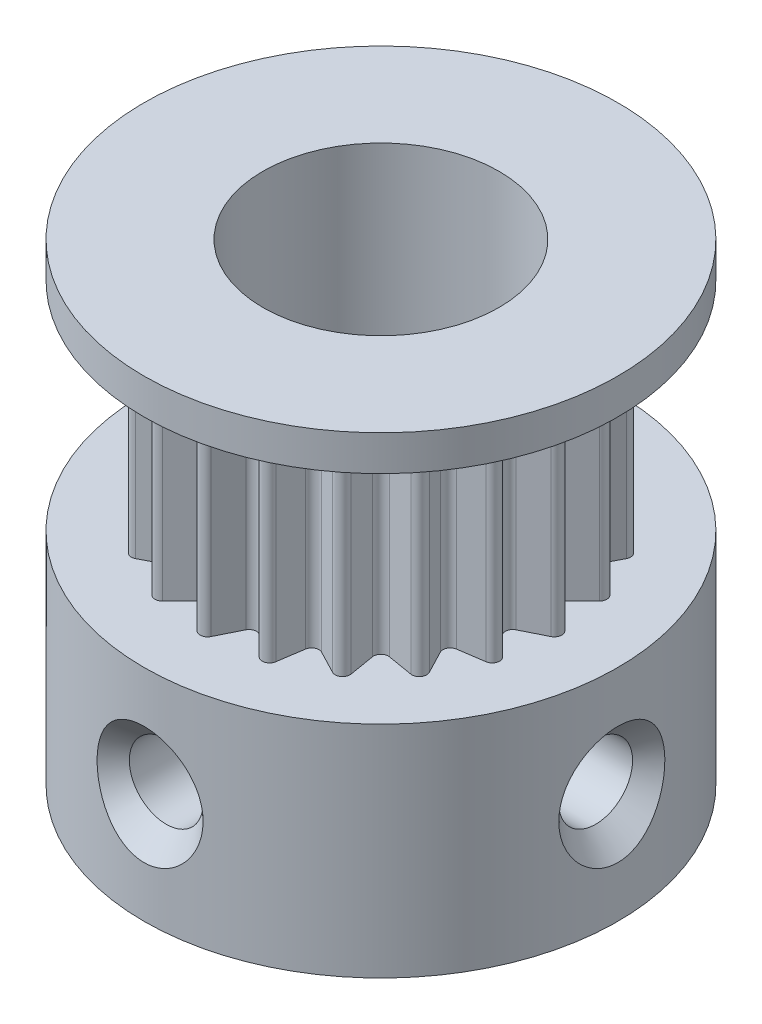
from build123d import *

# Parameters (mm, degrees)
SKETCH1_R           = 8.025
BOSS_EXTRUDE1_DEPTH = 16
CUT_EXTRUDE1_START  = -8.55
SKETCH2_R           = 8.025
CUT_EXTRUDE1_DEPTH  = 7.35
SKETCH3_R           = 4
CUT_EXTRUDE2_DEPTH  = 20.616351598
CIRPATTERN1_COUNT   = 2
CIRPATTERN1_ANGLE   = 90


# Read off the part's stored shape, not the designer's step: M3x0.5 Tapped Hole1
with BuildPart() as part:
    # Sketch1 → Boss-Extrude1 (new body)
    with BuildSketch(Plane(origin=(0, 0, 0), x_dir=(1, 0, 0), z_dir=(0, 1, 0))):
        with Locations(Location((0, 0, 0), (0, 0, 270))):
            Circle(SKETCH1_R)
    extrude(amount=BOSS_EXTRUDE1_DEPTH)

    # Sketch2 → Cut-Extrude1 (cut)
    with BuildSketch(Plane(origin=(0, 16, 0), x_dir=(1, 0, 0), z_dir=(0, 1, 0)).offset(CUT_EXTRUDE1_START)):
        with Locations(Location((0, 0, 0), (0, 0, 270))):
            Circle(SKETCH2_R)
        with BuildLine():
            Line((0.223750509, 5.986515514), (0.617084741, 5.197309317))
            ThreePointArc((0.617084741, 5.197309317), (0.801726633, 5.061902746), (1.01917444, 5.133624565))
            Line((1.01917444, 5.133624565), (1.637135651, 5.762657299))
            ThreePointArc((1.637135651, 5.762657299), (1.756034951, 5.830288043), (1.892729091, 5.825221162))
            ThreePointArc((1.892729091, 5.825221162), (2.00629521, 5.748973556), (2.06273441, 5.62437188))
            Line((2.06273441, 5.62437188), (2.192939368, 4.752245221))
            ThreePointArc((2.192939368, 4.752245221), (2.326701311, 4.566408436), (2.555669726, 4.567424872))
            Line((2.555669726, 4.567424872), (3.337767568, 4.974710037))
            ThreePointArc((3.337767568, 4.974710037), (3.471746571, 5.002288793), (3.60018467, 4.955229091))
            ThreePointArc((3.60018467, 4.955229091), (3.684630662, 4.847619447), (3.699803496, 4.711675538))
            Line((3.699803496, 4.711675538), (3.55413381, 3.841998252))
            ThreePointArc((3.55413381, 3.841998252), (3.623922254, 3.623922254), (3.841998252, 3.55413381))
            Line((3.841998252, 3.55413381), (4.711675538, 3.699803496))
            ThreePointArc((4.711675538, 3.699803496), (4.847619447, 3.684630662), (4.955229091, 3.60018467))
            ThreePointArc((4.955229091, 3.60018467), (5.002288793, 3.471746571), (4.974710037, 3.337767568))
            Line((4.974710037, 3.337767568), (4.567424872, 2.555669726))
            ThreePointArc((4.567424872, 2.555669726), (4.566408436, 2.326701311), (4.752245221, 2.192939368))
            Line((4.752245221, 2.192939368), (5.62437188, 2.06273441))
            ThreePointArc((5.62437188, 2.06273441), (5.748973556, 2.00629521), (5.825221162, 1.892729091))
            ThreePointArc((5.825221162, 1.892729091), (5.830288043, 1.756034951), (5.762657299, 1.637135651))
            Line((5.762657299, 1.637135651), (5.133624565, 1.01917444))
            ThreePointArc((5.133624565, 1.01917444), (5.061902746, 0.801726633), (5.197309317, 0.617084741))
            Line((5.197309317, 0.617084741), (5.986515514, 0.223750509))
            ThreePointArc((5.986515514, 0.223750509), (6.087578078, 0.131569604), (6.125, 0))
            ThreePointArc((6.125, 0), (6.087578078, -0.131569604), (5.986515514, -0.223750509))
            Line((5.986515514, -0.223750509), (5.197309317, -0.617084741))
            ThreePointArc((5.197309317, -0.617084741), (5.061902746, -0.801726633), (5.133624565, -1.01917444))
            Line((5.133624565, -1.01917444), (5.762657299, -1.637135651))
            ThreePointArc((5.762657299, -1.637135651), (5.830288043, -1.756034951), (5.825221162, -1.892729091))
            ThreePointArc((5.825221162, -1.892729091), (5.748973556, -2.00629521), (5.62437188, -2.06273441))
            Line((5.62437188, -2.06273441), (4.752245221, -2.192939368))
            ThreePointArc((4.752245221, -2.192939368), (4.566408436, -2.326701311), (4.567424872, -2.555669726))
            Line((4.567424872, -2.555669726), (4.974710037, -3.337767568))
            ThreePointArc((4.974710037, -3.337767568), (5.002288793, -3.471746571), (4.955229091, -3.60018467))
            ThreePointArc((4.955229091, -3.60018467), (4.847619447, -3.684630662), (4.711675538, -3.699803496))
            Line((4.711675538, -3.699803496), (3.841998252, -3.55413381))
            ThreePointArc((3.841998252, -3.55413381), (3.623922254, -3.623922254), (3.55413381, -3.841998252))
            Line((3.55413381, -3.841998252), (3.699803496, -4.711675538))
            ThreePointArc((3.699803496, -4.711675538), (3.684630662, -4.847619447), (3.60018467, -4.955229091))
            ThreePointArc((3.60018467, -4.955229091), (3.471746571, -5.002288793), (3.337767568, -4.974710037))
            Line((3.337767568, -4.974710037), (2.555669726, -4.567424872))
            ThreePointArc((2.555669726, -4.567424872), (2.326701311, -4.566408436), (2.192939368, -4.752245221))
            Line((2.192939368, -4.752245221), (2.06273441, -5.62437188))
            ThreePointArc((2.06273441, -5.62437188), (2.00629521, -5.748973556), (1.892729091, -5.825221162))
            ThreePointArc((1.892729091, -5.825221162), (1.756034951, -5.830288043), (1.637135651, -5.762657299))
            Line((1.637135651, -5.762657299), (1.01917444, -5.133624565))
            ThreePointArc((1.01917444, -5.133624565), (0.801726633, -5.061902746), (0.617084741, -5.197309317))
            Line((0.617084741, -5.197309317), (0.223750509, -5.986515514))
            ThreePointArc((0.223750509, -5.986515514), (0.131569604, -6.087578078), (0, -6.125))
            ThreePointArc((0, -6.125), (-0.131569604, -6.087578078), (-0.223750509, -5.986515514))
            Line((-0.223750509, -5.986515514), (-0.617084741, -5.197309317))
            ThreePointArc((-0.617084741, -5.197309317), (-0.801726633, -5.061902746), (-1.01917444, -5.133624565))
            Line((-1.01917444, -5.133624565), (-1.637135651, -5.762657299))
            ThreePointArc((-1.637135651, -5.762657299), (-1.756034951, -5.830288043), (-1.892729091, -5.825221162))
            ThreePointArc((-1.892729091, -5.825221162), (-2.00629521, -5.748973556), (-2.06273441, -5.62437188))
            Line((-2.06273441, -5.62437188), (-2.192939368, -4.752245221))
            ThreePointArc((-2.192939368, -4.752245221), (-2.326701311, -4.566408436), (-2.555669726, -4.567424872))
            Line((-2.555669726, -4.567424872), (-3.337767568, -4.974710037))
            ThreePointArc((-3.337767568, -4.974710037), (-3.471746571, -5.002288793), (-3.60018467, -4.955229091))
            ThreePointArc((-3.60018467, -4.955229091), (-3.684630662, -4.847619447), (-3.699803496, -4.711675538))
            Line((-3.699803496, -4.711675538), (-3.55413381, -3.841998252))
            ThreePointArc((-3.55413381, -3.841998252), (-3.623922254, -3.623922254), (-3.841998252, -3.55413381))
            Line((-3.841998252, -3.55413381), (-4.711675538, -3.699803496))
            ThreePointArc((-4.711675538, -3.699803496), (-4.847619447, -3.684630662), (-4.955229091, -3.60018467))
            ThreePointArc((-4.955229091, -3.60018467), (-5.002288793, -3.471746571), (-4.974710037, -3.337767568))
            Line((-4.974710037, -3.337767568), (-4.567424872, -2.555669726))
            ThreePointArc((-4.567424872, -2.555669726), (-4.566408436, -2.326701311), (-4.752245221, -2.192939368))
            Line((-4.752245221, -2.192939368), (-5.62437188, -2.06273441))
            ThreePointArc((-5.62437188, -2.06273441), (-5.748973556, -2.00629521), (-5.825221162, -1.892729091))
            ThreePointArc((-5.825221162, -1.892729091), (-5.830288043, -1.756034951), (-5.762657299, -1.637135651))
            Line((-5.762657299, -1.637135651), (-5.133624565, -1.01917444))
            ThreePointArc((-5.133624565, -1.01917444), (-5.061902746, -0.801726633), (-5.197309317, -0.617084741))
            Line((-5.197309317, -0.617084741), (-5.986515514, -0.223750509))
            ThreePointArc((-5.986515514, -0.223750509), (-6.087578078, -0.131569604), (-6.125, 0))
            ThreePointArc((-6.125, 0), (-6.087578078, 0.131569604), (-5.986515514, 0.223750509))
            Line((-5.986515514, 0.223750509), (-5.197309317, 0.617084741))
            ThreePointArc((-5.197309317, 0.617084741), (-5.061902746, 0.801726633), (-5.133624565, 1.01917444))
            Line((-5.133624565, 1.01917444), (-5.762657299, 1.637135651))
            ThreePointArc((-5.762657299, 1.637135651), (-5.830288043, 1.756034951), (-5.825221162, 1.892729091))
            ThreePointArc((-5.825221162, 1.892729091), (-5.748973556, 2.00629521), (-5.62437188, 2.06273441))
            Line((-5.62437188, 2.06273441), (-4.752245221, 2.192939368))
            ThreePointArc((-4.752245221, 2.192939368), (-4.566408436, 2.326701311), (-4.567424872, 2.555669726))
            Line((-4.567424872, 2.555669726), (-4.974710037, 3.337767568))
            ThreePointArc((-4.974710037, 3.337767568), (-5.002288793, 3.471746571), (-4.955229091, 3.60018467))
            ThreePointArc((-4.955229091, 3.60018467), (-4.847619447, 3.684630662), (-4.711675538, 3.699803496))
            Line((-4.711675538, 3.699803496), (-3.841998252, 3.55413381))
            ThreePointArc((-3.841998252, 3.55413381), (-3.623922254, 3.623922254), (-3.55413381, 3.841998252))
            Line((-3.55413381, 3.841998252), (-3.699803496, 4.711675538))
            ThreePointArc((-3.699803496, 4.711675538), (-3.684630662, 4.847619447), (-3.60018467, 4.955229091))
            ThreePointArc((-3.60018467, 4.955229091), (-3.471746571, 5.002288793), (-3.337767568, 4.974710037))
            Line((-3.337767568, 4.974710037), (-2.555669726, 4.567424872))
            ThreePointArc((-2.555669726, 4.567424872), (-2.326701311, 4.566408436), (-2.192939368, 4.752245221))
            Line((-2.192939368, 4.752245221), (-2.06273441, 5.62437188))
            ThreePointArc((-2.06273441, 5.62437188), (-2.00629521, 5.748973556), (-1.892729091, 5.825221162))
            ThreePointArc((-1.892729091, 5.825221162), (-1.756034951, 5.830288043), (-1.637135651, 5.762657299))
            Line((-1.637135651, 5.762657299), (-1.01917444, 5.133624565))
            ThreePointArc((-1.01917444, 5.133624565), (-0.801726633, 5.061902746), (-0.617084741, 5.197309317))
            Line((-0.617084741, 5.197309317), (-0.223750509, 5.986515514))
            ThreePointArc((-0.223750509, 5.986515514), (-0.131569604, 6.087578078), (0, 6.125))
            ThreePointArc((0, 6.125), (0.131569604, 6.087578078), (0.223750509, 5.986515514))
        make_face(mode=Mode.SUBTRACT)
    extrude(amount=CUT_EXTRUDE1_DEPTH, mode=Mode.SUBTRACT)

    # Sketch3 → Cut-Extrude2 (cut, through all)
    with BuildSketch(Plane(origin=(0, 16, 0), x_dir=(1, 0, 0), z_dir=(0, 1, 0))):
        with Locations(Location((0, 0, 0), (0, 0, 270))):
            Circle(SKETCH3_R)
    extrude(amount=-CUT_EXTRUDE2_DEPTH, mode=Mode.SUBTRACT)

    # M3x0.5 Tapped Hole1 outline → M3x0.5 Tapped Hole1 (revolve, cut)
    with BuildSketch(Plane.XZ.offset(-3.725)):
        Polygon((2.000000319, 8.025000319), (0, 8.025000319), (0, 3.799586083), (1.25, 3.799586083), (1.25, 7.275), align=None)
    m3x0_5_tapped_hole1 = revolve(axis=Axis((0, 3.725, 0), (0, 0, 1)), mode=Mode.SUBTRACT)

    # CirPattern1: M3x0.5 Tapped Hole1 ×2 about axis
    cirpattern1_axis = Axis((0, 16, 0), (0, 1, 0))
    for i in range(1, CIRPATTERN1_COUNT):
        add(m3x0_5_tapped_hole1.rotate(cirpattern1_axis, i * CIRPATTERN1_ANGLE / (CIRPATTERN1_COUNT - 1)), mode=Mode.SUBTRACT)


solid = part.part
